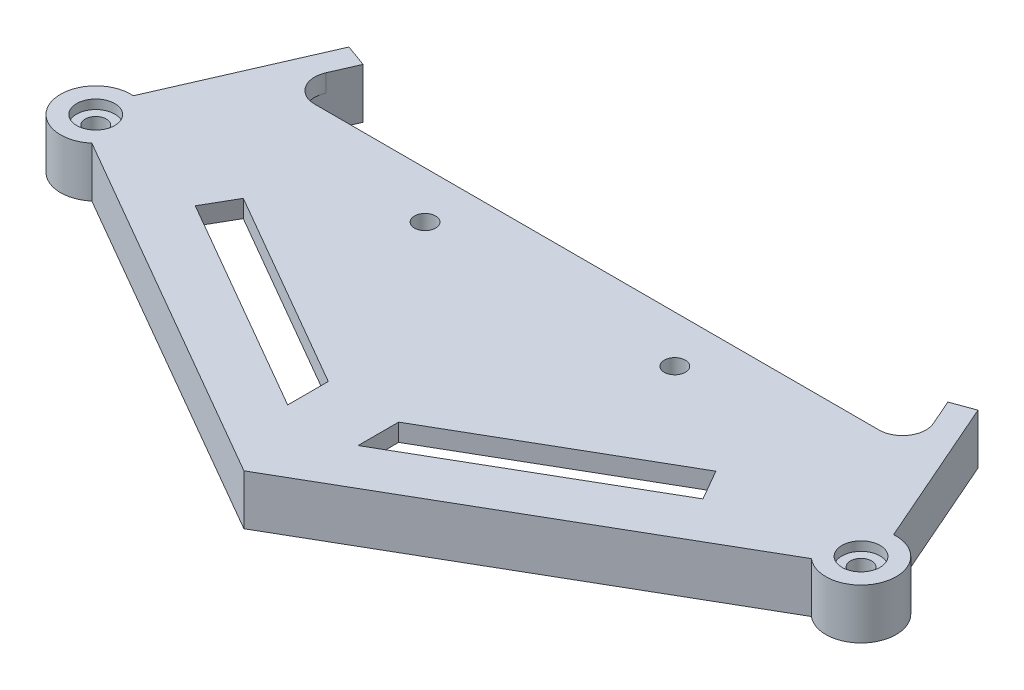
from build123d import *
from build123d.topology import SkipClean

# Parameters (mm, degrees)
SKETCH1_R           = 1.8
BOSS_EXTRUDE1_DEPTH = 4
FILLET1_R           = 4
CUT_EXTRUDE2_REACH  = 103.08
BOSS_EXTRUDE3_START = 5.55799
BOSS_EXTRUDE3_DEPTH = 5.55799
SKETCH6_R           = 1.8
CUT_EXTRUDE3_DEPTH  = 102.153572382
BOSS_EXTRUDE6_START = 0.56
SKETCH17_R          = 6
SKETCH17_R_2        = 1.8
BOSS_EXTRUDE6_DEPTH = 0.56
CUT_EXTRUDE13_START = -2.56
SKETCH18_R          = 6
SKETCH18_R_2        = 1.8
CUT_EXTRUDE13_DEPTH = 2.56
BOSS_EXTRUDE7_START = 4.99799
SKETCH19_R          = 6
SKETCH19_R_2        = 3.25
BOSS_EXTRUDE7_DEPTH = 4.99799
SKETCH20_R          = 6
SKETCH20_R_2        = 3.25
BOSS_EXTRUDE8_DEPTH = 2.56
SKETCH21_W          = 180.141886337
SKETCH21_H          = 87.597084555
CUT_EXTRUDE14_DEPTH = 1


with BuildPart() as part:
    # Sketch1 → Boss-Extrude1 (new body)
    with BuildSketch(Plane(origin=(0, 0, 0), x_dir=(1, 0, 0), z_dir=(0, 1, 0))):
        with BuildLine():
            Line((-61.369632465, 35.431773824), (0, 0))
            Line((0, 0), (61.369632465, 35.431773824))
            ThreePointArc((61.369632465, 35.431773824), (70.968700885, 38.119022954), (64.834981957, 45.97656166))
            Line((64.834981957, 45.97656166), (53.646129321, 71.567722497))
            Line((53.646129321, 71.567722497), (49.879862047, 70.196913315))
            Line((49.879862047, 70.196913315), (54.252017225, 60.196913315))
            Line((54.252017225, 60.196913315), (-54.252017225, 60.196913315))
            Line((-54.252017225, 60.196913315), (-49.879862047, 70.196913315))
            Line((-49.879862047, 70.196913315), (-53.646129321, 71.567722497))
            Line((-53.646129321, 71.567722497), (-64.834981957, 45.97656166))
            ThreePointArc((-64.834981957, 45.97656166), (-70.968700885, 38.119022954), (-61.369632465, 35.431773824))
        make_face()
        with Locations(Location((-65.268611951, 39.992251756, 0), (0, 0, 270))):
            Circle(SKETCH1_R, mode=Mode.SUBTRACT)
        with Locations(Location((65.268611951, 39.992251756, 0), (0, 0, 270))):
            Circle(SKETCH1_R, mode=Mode.SUBTRACT)
    extrude(amount=BOSS_EXTRUDE1_DEPTH)

    # Fillet1
    fillet1_edges = [part.edges().sort_by_distance(p)[0] for p in [
        (-54.252017225, 2, -60.196913315),
        (54.252017225, 2, -60.196913315),
    ]]
    fillet(fillet1_edges, radius=FILLET1_R)

    # Sketch4 → Cut-Extrude2 (cut, up to next)
    with BuildSketch(Plane(origin=(0, 4, 0), x_dir=(1, 0, 0), z_dir=(0, 1, 0)), mode=Mode.PRIVATE) as cut_extrude2_sk1:
        Polygon((6, 13.464101615), (43.301270189, 35), (40.301270189, 40.196152423), (6, 20.392304845), align=None)
    cut_extrude2_tool1 = extrude(cut_extrude2_sk1.sketch, amount=-CUT_EXTRUDE2_REACH, mode=Mode.PRIVATE) & part.part
    # Sketch4 → Cut-Extrude2 (cut, up to next)
    with BuildSketch(Plane(origin=(0, 4, 0), x_dir=(1, 0, 0), z_dir=(0, 1, 0)), mode=Mode.PRIVATE) as cut_extrude2_sk2:
        Polygon((-43.301270189, 35), (-6, 13.464101615), (-6, 20.392304845), (-40.301270189, 40.196152423), align=None)
    cut_extrude2_tool2 = extrude(cut_extrude2_sk2.sketch, amount=-CUT_EXTRUDE2_REACH, mode=Mode.PRIVATE) & part.part
    add(cut_extrude2_tool1.solids().sort_by_distance((23.91111, 4, -27.220808))[0], mode=Mode.SUBTRACT)
    add(cut_extrude2_tool2.solids().sort_by_distance((-23.91111, 4, -27.220808))[0], mode=Mode.SUBTRACT)

    # Sketch5 → Boss-Extrude3 (add)
    with BuildSketch(Plane.XZ.offset(BOSS_EXTRUDE3_START)):
        with BuildLine():
            Line((-64.834981957, -45.97656166), (-53.646129321, -71.567722497))
            Line((-53.646129321, -71.567722497), (-49.879862047, -70.196913315))
            Line((-49.879862047, -70.196913315), (-51.802560936, -65.79931348))
            Line((-51.802560936, -65.79931348), (-61.169969855, -44.374161496))
            ThreePointArc((-61.169969855, -44.374161496), (-62.865011704, -45.48976991), (-64.834981957, -45.97656166))
        make_face()
        with BuildLine():
            ThreePointArc((-61.369632465, -35.431773824), (-60.072459528, -36.992251756), (-59.369632465, -38.895875439))
            Line((-59.369632465, -38.895875439), (0, -4.618802154))
            Line((0, -4.618802154), (59.369632465, -38.895875439))
            ThreePointArc((59.369632465, -38.895875439), (60.072459528, -36.992251756), (61.369632465, -35.431773824))
            Line((61.369632465, -35.431773824), (0, 0))
            Line((0, 0), (-61.369632465, -35.431773824))
        make_face()
        with BuildLine():
            ThreePointArc((64.834981957, -45.97656166), (62.865011704, -45.48976991), (61.169969855, -44.374161496))
            Line((61.169969855, -44.374161496), (51.802560936, -65.79931348))
            Line((51.802560936, -65.79931348), (49.879862047, -70.196913315))
            Line((49.879862047, -70.196913315), (53.646129321, -71.567722497))
            Line((53.646129321, -71.567722497), (64.834981957, -45.97656166))
        make_face()
    extrude(amount=-BOSS_EXTRUDE3_DEPTH)

    # Sketch6 → Cut-Extrude3 (cut, through all)
    with BuildSketch(Plane.XZ):
        with Locations(Location((-21.3, -52.196913315, 0), (0, 0, 270))):
            Circle(SKETCH6_R)
        with Locations(Location((21.3, -52.196913315, 0), (0, 0, 270))):
            Circle(SKETCH6_R)
    extrude(amount=-CUT_EXTRUDE3_DEPTH, mode=Mode.SUBTRACT)

    # Sketch17 → Boss-Extrude6 (add)
    # profile 1 of 2: a face of its own
    with BuildSketch(Plane.XZ.offset(BOSS_EXTRUDE6_START)):
        with Locations((65.268611951, -39.992251756)):
            Circle(SKETCH17_R)
        with Locations(Location((65.268611951, -39.992251756, 0), (0, 0, 270))):
            Circle(SKETCH17_R_2, mode=Mode.SUBTRACT)
    # profile 2 of 2: a face of its own
    with BuildSketch(Plane.XZ.offset(BOSS_EXTRUDE6_START)):
        with Locations((-65.268611951, -39.992251756)):
            Circle(SKETCH17_R)
        with Locations(Location((-65.268611951, -39.992251756, 0), (0, 0, 270))):
            Circle(SKETCH17_R_2, mode=Mode.SUBTRACT)
    extrude(amount=-BOSS_EXTRUDE6_DEPTH)

    # Sketch18 → Cut-Extrude13 (cut)
    # profile 1 of 2: a face of its own
    with BuildSketch(Plane(origin=(0, 4, 0), x_dir=(1, 0, 0), z_dir=(0, 1, 0)).offset(CUT_EXTRUDE13_START)):
        with Locations((-65.268611951, 39.992251756)):
            Circle(SKETCH18_R)
        with Locations(Location((-65.268611951, 39.992251756, 0), (0, 0, 90))):
            Circle(SKETCH18_R_2, mode=Mode.SUBTRACT)
    # profile 2 of 2: a face of its own
    with BuildSketch(Plane(origin=(0, 4, 0), x_dir=(1, 0, 0), z_dir=(0, 1, 0)).offset(CUT_EXTRUDE13_START)):
        with Locations((65.268611951, 39.992251756)):
            Circle(SKETCH18_R)
        with Locations(Location((65.268611951, 39.992251756, 0), (0, 0, 90))):
            Circle(SKETCH18_R_2, mode=Mode.SUBTRACT)
    extrude(amount=CUT_EXTRUDE13_DEPTH, mode=Mode.SUBTRACT)

    # Sketch19 → Boss-Extrude7 (add)
    # profile 1 of 2: a face of its own
    with BuildSketch(Plane.XZ.offset(0.56).offset(BOSS_EXTRUDE7_START)):
        with Locations((-65.268611951, -39.992251756)):
            Circle(SKETCH19_R)
        with Locations(Location((-65.268611951, -39.992251756, 0), (0, 0, 270))):
            Circle(SKETCH19_R_2, mode=Mode.SUBTRACT)
    # profile 2 of 2: a face of its own
    with BuildSketch(Plane.XZ.offset(0.56).offset(BOSS_EXTRUDE7_START)):
        with Locations((65.268611951, -39.992251756)):
            Circle(SKETCH19_R)
        with Locations(Location((65.268611951, -39.992251756, 0), (0, 0, 270))):
            Circle(SKETCH19_R_2, mode=Mode.SUBTRACT)
    extrude(amount=-BOSS_EXTRUDE7_DEPTH)

    # Sketch20 → Boss-Extrude8 (add)
    # profile 1 of 2: a face of its own
    with BuildSketch(Plane(origin=(0, 1.44, 0), x_dir=(1, 0, 0), z_dir=(0, 1, 0))):
        with Locations((-65.268611951, 39.992251756)):
            Circle(SKETCH20_R)
        with Locations(Location((-65.268611951, 39.992251756, 0), (0, 0, 90))):
            Circle(SKETCH20_R_2, mode=Mode.SUBTRACT)
    # profile 2 of 2: a face of its own
    with BuildSketch(Plane(origin=(0, 1.44, 0), x_dir=(1, 0, 0), z_dir=(0, 1, 0))):
        with Locations((65.268611951, 39.992251756)):
            Circle(SKETCH20_R)
        with Locations(Location((65.268611951, 39.992251756, 0), (0, 0, 90))):
            Circle(SKETCH20_R_2, mode=Mode.SUBTRACT)
    extrude(amount=BOSS_EXTRUDE8_DEPTH)

    # Sketch21 → Cut-Extrude14 (cut)
    with SkipClean():  # the faces are left unmerged after this step: merging them gives an invalid solid
        with BuildSketch(Plane(origin=(0, 4, 0), x_dir=(1, 0, 0), z_dir=(0, 1, 0))):
            with Locations((-2.136514257, 36.289877784)):
                Rectangle(SKETCH21_W, SKETCH21_H)
        extrude(amount=-CUT_EXTRUDE14_DEPTH, mode=Mode.SUBTRACT)


solid = part.part
